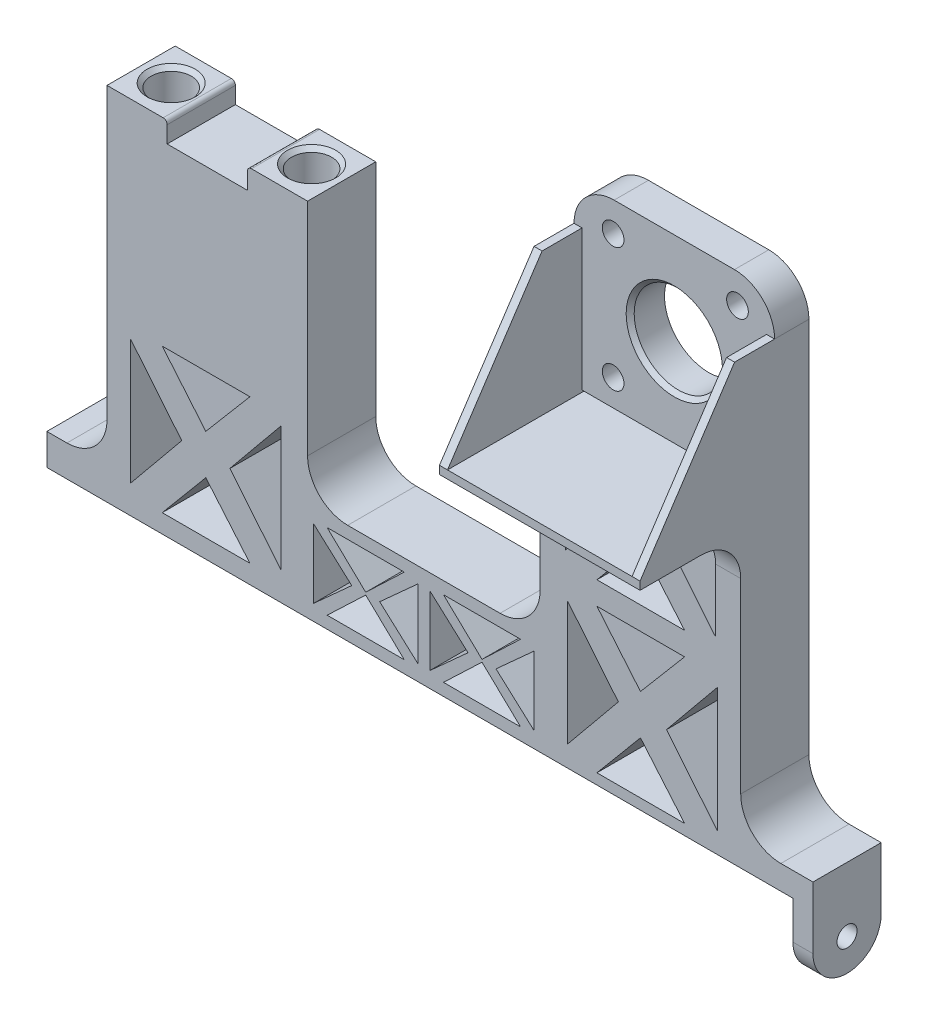
from build123d import *

# Parameters (mm, degrees)
CROQUIS1_R                = 11
SALIENTE_EXTRUIR1_DEPTH   = 17
REDONDEO1_R               = 10
REDONDEO2_R               = 10
REDONDEO8_R               = 10
REDONDEO9_R               = 10
REDONDEO11_R              = 10
REDONDEO12_R              = 10
SALIENTE_EXTRUIR2_DEPTH   = 186
CROQUIS5_R                = 2.5
SALIENTE_EXTRUIR6_DEPTH   = 5
CORTAR_EXTRUIR5_START     = -5
CORTAR_EXTRUIR5_OUTLINE_R = 11
CORTAR_EXTRUIR5_DEPTH     = 5
SALIENTE_EXTRUIR7_DEPTH   = 2
SALIENTE_EXTRUIR8_DEPTH   = 2
CROQUIS16_W               = 46
CROQUIS16_H               = 26.427047574
SALIENTE_EXTRUIR9_DEPTH   = 2
CROQUIS18_W               = 50
CROQUIS18_H               = 8.439754805
CORTAR_EXTRUIR7_DEPTH     = 45
CROQUIS19_W               = 2
CROQUIS19_H               = 8.439754805
SALIENTE_EXTRUIR10_DEPTH  = 35
CROQUIS20_W               = 46
CROQUIS20_H               = 0.485157357
CORTAR_EXTRUIR8_DEPTH     = 9
REDONDEO13_R              = 10
SKETCH1_W                 = 1.328368311
SKETCH1_H                 = 2
CUT_EXTRUDE1_DEPTH        = 215.967115272
SKETCH3_R                 = 2.7
CUT_EXTRUDE2_DEPTH        = 161.549988464
SKETCH4_R                 = 5
CUT_EXTRUDE3_DEPTH        = 17.5
FILLET1_R                 = 1
CHAMFER1_SIZE             = 1


# Read off the part's stored shape, not the designer's step: Cortar-Extruir5
with BuildPart() as part:
    # Croquis1 → Saliente-Extruir1 (new body)
    with BuildSketch(Plane.XY):
        Polygon((-93, 0), (93, 0), (93, 6), (79.988300723, 6), (79.988300723, 120), (29.988300723, 120), (29.988300723, 25.013938177), (-28, 25.013938177), (-28, 90), (-43, 90), (-43, 84.845258293), (-63, 84.845258293), (-63, 90), (-78, 90), (-78, 7.786589187), (-93, 7.786589187), align=None)
        Polygon((-53.370368055, 17.608830496), (-42.369998576, 4.626570416), (-64.231453048, 4.626570416), align=None, mode=Mode.SUBTRACT)
        Polygon((-72.099249791, 38.14298816), (-59.370368055, 22.608830496), (-72.099249791, 7.074672833), align=None, mode=Mode.SUBTRACT)
        Polygon((-3.887274434, 3.04639267), (-23.118575204, 3.04639267), (-13.502924819, 12.205387461), align=None, mode=Mode.SUBTRACT)
        Polygon((-26.514516656, 3.893494584), (-26.514516656, 21.120443592), (-16.989907544, 12.506969088), align=None, mode=Mode.SUBTRACT)
        Polygon((-10.015942094, 12.506969088), (-0.491332982, 21.120443592), (-0.491332982, 3.893494584), align=None, mode=Mode.SUBTRACT)
        Polygon((-34.641486319, 7.074672833), (-47.370368055, 22.608830496), (-34.641486319, 38.14298816), align=None, mode=Mode.SUBTRACT)
        Polygon((-13.502924819, 12.808550716), (-23.118575204, 21.967545507), (-3.887274434, 21.967545507), align=None, mode=Mode.SUBTRACT)
        Polygon((-53.370368055, 27.608830496), (-64.231453048, 40.591090577), (-42.369998576, 40.591090577), align=None, mode=Mode.SUBTRACT)
        Polygon((2.479633706, 3.893494584), (2.479633706, 21.120443592), (12.004242818, 12.506969088), align=None, mode=Mode.SUBTRACT)
        Polygon((5.875575158, 3.04639267), (15.491225543, 12.205387461), (25.106875927, 3.04639267), align=None, mode=Mode.SUBTRACT)
        Polygon((28.50281738, 21.120443592), (28.50281738, 3.893494584), (18.978208267, 12.506969088), align=None, mode=Mode.SUBTRACT)
        Polygon((5.875575158, 21.967545507), (25.106875927, 21.967545507), (15.491225543, 12.808550716), align=None, mode=Mode.SUBTRACT)
        Polygon((36.750632631, 36.163668304), (49.479514367, 20.629510641), (36.750632631, 5.095352977), align=None, mode=Mode.SUBTRACT)
        Polygon((55, 15.629510641), (66.000369479, 2.64725056), (44.138915007, 2.64725056), align=None, mode=Mode.SUBTRACT)
        Polygon((74.208396103, 5.095352977), (61.479514367, 20.629510641), (74.208396103, 36.163668304), align=None, mode=Mode.SUBTRACT)
        Polygon((40.681467462, 72.45853374), (48.988300723, 62.320985113), (36.271118264, 46.772549809), (36.271118264, 72.45853374), align=None, mode=Mode.SUBTRACT)
        Polygon((55, 25.629510641), (44.138915007, 38.611770721), (66.000369479, 38.611770721), align=None, mode=Mode.SUBTRACT)
        Polygon((55, 57.306707472), (66.000369479, 44.324447392), (44.138915007, 44.324447392), align=None, mode=Mode.SUBTRACT)
        Polygon((73.728881736, 46.772549809), (60.988300723, 62.320985113), (69.295133985, 72.45853374), (73.728881736, 72.45853374), align=None, mode=Mode.SUBTRACT)
        with Locations((54.988300723, 97)):
            Circle(CROQUIS1_R, mode=Mode.SUBTRACT)
    extrude(amount=SALIENTE_EXTRUIR1_DEPTH)

    # Redondeo1
    redondeo1_edges = [part.edges().sort_by_distance(p)[0] for p in [
        (79.988300723, 120, 8.5),
    ]]
    fillet(redondeo1_edges, radius=REDONDEO1_R)

    # Redondeo2
    redondeo2_edges = [part.edges().sort_by_distance(p)[0] for p in [
        (29.988300723, 120, 8.5),
    ]]
    fillet(redondeo2_edges, radius=REDONDEO2_R)

    # Redondeo8
    redondeo8_edges = [part.edges().sort_by_distance(p)[0] for p in [
        (29.988300723, 25.013938177, 8.5),
    ]]
    fillet(redondeo8_edges, radius=REDONDEO8_R)

    # Redondeo9
    redondeo9_edges = [part.edges().sort_by_distance(p)[0] for p in [
        (-28, 25.013938177, 8.5),
    ]]
    fillet(redondeo9_edges, radius=REDONDEO9_R)

    # Redondeo11
    redondeo11_edges = [part.edges().sort_by_distance(p)[0] for p in [
        (79.988300723, 6, 8.5),
    ]]
    fillet(redondeo11_edges, radius=REDONDEO11_R)

    # Redondeo12
    redondeo12_edges = [part.edges().sort_by_distance(p)[0] for p in [
        (-78, 7.786589187, 8.5),
    ]]
    fillet(redondeo12_edges, radius=REDONDEO12_R)

    # Croquis4 → Saliente-Extruir2 (add)
    with BuildSketch(Plane.ZY.offset(93)):
        with BuildLine():
            Line((5.614135824, 0), (5.614135824, -2.2))
            Line((5.614135824, -2.2), (3.414135824, -2.2))
            Line((3.414135824, -2.2), (3.414135824, -3.7))
            Line((3.414135824, -3.7), (4.862457658, -5.028042266))
            ThreePointArc((4.862457658, -5.028042266), (5.488945101, -5.4178372), (6.214135824, -5.553943851))
            Line((6.214135824, -5.553943851), (10.014135824, -5.553943851))
            ThreePointArc((10.014135824, -5.553943851), (10.739326546, -5.4178372), (11.365813989, -5.028042266))
            Line((11.365813989, -5.028042266), (12.814135824, -3.7))
            Line((12.814135824, -3.7), (12.814135824, -2.2))
            Line((12.814135824, -2.2), (10.614135824, -2.2))
            Line((10.614135824, -2.2), (10.614135824, 0))
            Line((10.614135824, 0), (5.614135824, 0))
        make_face()
    extrude(amount=-SALIENTE_EXTRUIR2_DEPTH)

    # Croquis5 → Saliente-Extruir6 (add)
    with BuildSketch(Plane(origin=(93, 0, 0), x_dir=(0, 0, -1), z_dir=(1, 0, 0))):
        with BuildLine():
            Line((-17, 6), (0, 6))
            Line((0, 6), (0, 0))
            Line((0, 0), (0, -9.475176398))
            ThreePointArc((0, -9.475176398), (-8.5, -17.975176398), (-17, -9.475176398))
            Line((-17, -9.475176398), (-17, 0))
            Line((-17, 0), (-17, 6))
        make_face()
        with Locations(Location((-8.5, -10, 0), (0, 0, 90))):
            Circle(CROQUIS5_R, mode=Mode.SUBTRACT)
    extrude(amount=SALIENTE_EXTRUIR6_DEPTH)

    # Cortar-Extruir5 outline → Cortar-Extruir5 (cut)
    with BuildSketch(Plane.XY.offset(17).offset(CORTAR_EXTRUIR5_START)):
        with BuildLine():
            ThreePointArc((36.990583657, 100.021275878), (34.88853317, 96.589149148), (37.130323879, 93.246622476))
            Line((37.130323879, 93.246622476), (49.081988054, 86.302507362))
            ThreePointArc((49.081988054, 86.302507362), (55.135782124, 84.669748862), (61.191322119, 86.29602016))
            Line((61.191322119, 86.29602016), (73.177641255, 93.243103052))
            ThreePointArc((73.177641255, 93.243103052), (75.516378848, 96.608558865), (73.365004561, 100.096763995))
            Line((73.365004561, 100.096763995), (61.202501164, 107.163380194))
            ThreePointArc((61.202501164, 107.163380194), (55.196638443, 108.796017791), (49.176296726, 107.217607778))
            Line((49.176296726, 107.217607778), (36.990583657, 100.021275878))
        make_face()
        with Locations((54.988300723, 97)):
            Circle(CORTAR_EXTRUIR5_OUTLINE_R, mode=Mode.SUBTRACT)
    extrude(amount=CORTAR_EXTRUIR5_DEPTH, mode=Mode.SUBTRACT)

    # Croquis14 → Saliente-Extruir7 (add)
    with BuildSketch(Plane(origin=(79.988300723, 0, 0), x_dir=(0, 0, -1), z_dir=(1, 0, 0))):
        Polygon((-17, 110), (-17, 72.514842643), (-43.427047574, 72.514842643), (-18.53, 110), align=None)
    extrude(amount=-SALIENTE_EXTRUIR7_DEPTH)

    # Croquis15 → Saliente-Extruir8 (add)
    with BuildSketch(Plane.ZY.offset(-29.988300723)):
        Polygon((17, 110), (18.53, 110), (43.427047574, 72.514842643), (17, 72.514842643), align=None)
    extrude(amount=-SALIENTE_EXTRUIR8_DEPTH)

    # Croquis16 → Saliente-Extruir9 (add)
    with BuildSketch(Plane.XZ.offset(-72.514842643)):
        with Locations((54.988300723, 30.213523787)):
            Rectangle(CROQUIS16_W, CROQUIS16_H)
    extrude(amount=-SALIENTE_EXTRUIR9_DEPTH)

    # Croquis18 → Cortar-Extruir7 (cut)
    with BuildSketch(Plane(origin=(0, 120, 0), x_dir=(1, 0, 0), z_dir=(0, 1, 0))):
        with Locations((54.988300723, -12.780122598)):
            Rectangle(CROQUIS18_W, CROQUIS18_H)
    extrude(amount=-CORTAR_EXTRUIR7_DEPTH, mode=Mode.SUBTRACT)

    # Croquis19 → Saliente-Extruir10 (add)
    with BuildSketch(Plane(origin=(0, 110, 0), x_dir=(1, 0, 0), z_dir=(0, 1, 0))):
        with Locations((78.988300723, -12.780122598)):
            Rectangle(CROQUIS19_W, CROQUIS19_H)
        with Locations((30.988300723, -12.780122598)):
            Rectangle(CROQUIS19_W, CROQUIS19_H)
    extrude(amount=-SALIENTE_EXTRUIR10_DEPTH)

    # Croquis20 → Cortar-Extruir8 (cut)
    with BuildSketch(Plane.XY.offset(17)):
        with Locations((54.988300723, 74.757421322)):
            Rectangle(CROQUIS20_W, CROQUIS20_H)
    extrude(amount=-CORTAR_EXTRUIR8_DEPTH, mode=Mode.SUBTRACT)

    # Redondeo13
    # the kernel refuses this fillet: 10 mm, written as the material it adds along each edge
    with BuildSketch(Plane(origin=(79.988300723, 72.514842643, 17), x_dir=(0, 0, 1), z_dir=(-1, 0, 0))) as redondeo13_piece_1_section:
        with BuildLine():
            CenterArc((REDONDEO13_R, -REDONDEO13_R), REDONDEO13_R, 90, 90)
            Line((0, -REDONDEO13_R), (0, 0))
            Line((0, 0), (REDONDEO13_R, 0))
        make_face()
    redondeo13_piece_1 = extrude(amount=50, mode=Mode.PRIVATE)
    redondeo13_piece_1 = split(redondeo13_piece_1, bisect_by=Plane(origin=(76.85859123, 72.45853374, 21.649915329), z_dir=(0, 1, 0)), keep=Keep.TOP, mode=Mode.PRIVATE)
    add(redondeo13_piece_1)
    with BuildSketch(Plane(origin=(79.988300723, 72.514842643, 17), x_dir=(0, 0, 1), z_dir=(-1, 0, 0))) as redondeo13_piece_2_section:
        with BuildLine():
            CenterArc((REDONDEO13_R, -REDONDEO13_R), REDONDEO13_R, 90, 90)
            Line((0, -REDONDEO13_R), (0, 0))
            Line((0, 0), (REDONDEO13_R, 0))
        make_face()
    redondeo13_piece_2 = extrude(amount=75, mode=Mode.PRIVATE)
    redondeo13_piece_2 = split(redondeo13_piece_2, bisect_by=Plane(origin=(73.728881736, 70.226028868, 19.173289303), z_dir=(1, 0, 0)), keep=Keep.TOP, mode=Mode.PRIVATE)
    add(redondeo13_piece_2)
    with BuildSketch(Plane(origin=(104.988300723, 72.514842643, 17), x_dir=(0, 0, 1), z_dir=(-1, 0, 0))) as redondeo13_piece_3_section:
        with BuildLine():
            CenterArc((REDONDEO13_R, -REDONDEO13_R), REDONDEO13_R, 90, 90)
            Line((0, -REDONDEO13_R), (0, 0))
            Line((0, 0), (REDONDEO13_R, 0))
        make_face()
    redondeo13_piece_3 = extrude(amount=100, mode=Mode.PRIVATE)
    redondeo13_piece_3 = split(redondeo13_piece_3, bisect_by=Plane(origin=(62.565438467, 64.245703, 19.303543537), z_dir=(-0.7734905837611198, 0.6338077917104541, 0)), keep=Keep.TOP, mode=Mode.PRIVATE)
    redondeo13_piece_3 = split(redondeo13_piece_3, bisect_by=Plane(origin=(47.41116298, 64.245703, 19.303543537), z_dir=(0.7734905837611216, 0.6338077917104518, 0)), keep=Keep.TOP, mode=Mode.PRIVATE)
    add(redondeo13_piece_3)
    with BuildSketch(Plane(origin=(104.988300723, 72.514842643, 17), x_dir=(0, 0, 1), z_dir=(-1, 0, 0))) as redondeo13_piece_4_section:
        with BuildLine():
            CenterArc((REDONDEO13_R, -REDONDEO13_R), REDONDEO13_R, 90, 90)
            Line((0, -REDONDEO13_R), (0, 0))
            Line((0, 0), (REDONDEO13_R, 0))
        make_face()
    redondeo13_piece_4 = extrude(amount=75, mode=Mode.PRIVATE)
    redondeo13_piece_4 = split(redondeo13_piece_4, bisect_by=Plane(origin=(36.271118264, 70.226028868, 19.173289303), z_dir=(-1, 0, 0)), keep=Keep.TOP, mode=Mode.PRIVATE)
    add(redondeo13_piece_4)

    # Sketch1 → Cut-Extrude1 (cut, through all)
    with BuildSketch(Plane(origin=(79.988300723, 0, 0), x_dir=(0, 0, -1), z_dir=(1, 0, 0))):
        with Locations((-42.762863419, 73.514842643)):
            Rectangle(SKETCH1_W, SKETCH1_H)
    extrude(amount=-CUT_EXTRUDE1_DEPTH, mode=Mode.SUBTRACT)

    # Sketch3 → Cut-Extrude2 (cut, through all)
    with BuildSketch(Plane(origin=(0, 0, 0), x_dir=(-1, 0, 0), z_dir=(0, 0, -1))):
        with Locations((-70.738454865, 112.610749995)):
            Circle(SKETCH3_R)
        with Locations((-39.738300723, 81.610750001)):
            Circle(SKETCH3_R)
        with Locations((-70.738129703, 81.610750001)):
            Circle(SKETCH3_R)
        with Locations((-39.73822367, 112.610749995)):
            Circle(SKETCH3_R)
    extrude(amount=-CUT_EXTRUDE2_DEPTH, mode=Mode.SUBTRACT)

    # Sketch4 → Cut-Extrude3 (cut)
    with BuildSketch(Plane(origin=(0, 90, 0), x_dir=(1, 0, 0), z_dir=(0, 1, 0))):
        with Locations(Location((-70.5, -8.5, 0), (0, 0, 270))):
            Circle(SKETCH4_R)
        with Locations(Location((-35.5, -8.5, 0), (0, 0, 270))):
            Circle(SKETCH4_R)
    extrude(amount=-CUT_EXTRUDE3_DEPTH, mode=Mode.SUBTRACT)

    # Fillet1
    fillet1_edges = [part.edges().sort_by_distance(p)[0] for p in [
        (-63, 90, 8.5),
        (-43, 90, 8.5),
    ]]
    fillet(fillet1_edges, radius=FILLET1_R)

    # Chamfer1
    chamfer1_edges = [part.edges().sort_by_distance(p)[0] for p in [
        (43.988300723, 97, 8.560245195),
        (-70.5, 90, 3.5),
        (-35.5, 90, 3.5),
    ]]
    chamfer(chamfer1_edges, length=CHAMFER1_SIZE)


solid = part.part
